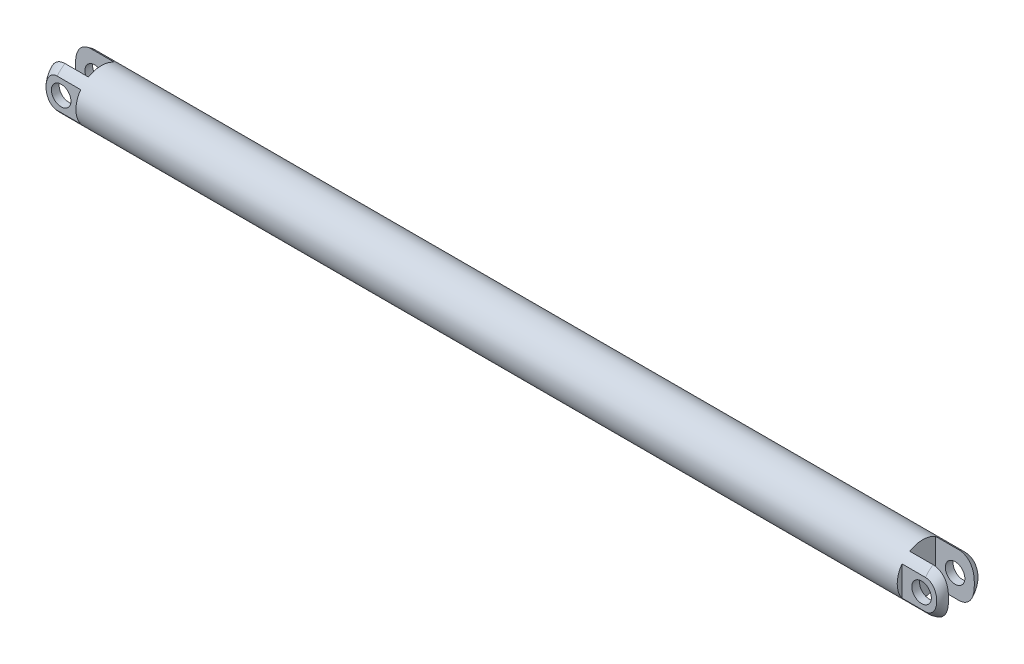
from build123d import *
from build123d.topology import SkipClean

# Parameters (mm, degrees)
SKETCH1_R            = 8.255
BOSS_EXTRUDE1_DEPTH  = 266.7
BOSS_EXTRUDE2_START  = 12.7
BOSS_EXTRUDE2_DEPTH  = 12.7
SKETCH5_R            = 3.175
CUT_EXTRUDE1_DEPTH   = 268.246525418
FILLET2_R            = 5.08
FILLET2_OF_MIRROR1_R = 5.08


with BuildPart() as part:
    # Sketch1 → Boss-Extrude1 (new body)
    with BuildSketch(Plane.YZ):
        with Locations(Location((0, 0, 0), (0, 0, 270))):
            Circle(SKETCH1_R)
    boss_extrude1 = extrude(amount=-BOSS_EXTRUDE1_DEPTH)

    # Sketch4 → Boss-Extrude2 (add)
    with SkipClean():  # the faces are left unmerged after this step: merging them gives an invalid solid
        with BuildSketch(Plane.YZ.offset(BOSS_EXTRUDE2_START)):
            with BuildLine():
                Line((-7.113903851, -4.187767543), (7.113903851, -4.187767543))
                ThreePointArc((7.113903851, -4.187767543), (6.098527778, -5.563540594), (4.821496361, -6.700611751))
                Line((4.821496361, -6.700611751), (-4.821496361, -6.700611751))
                ThreePointArc((-4.821496361, -6.700611751), (-6.098527778, -5.563540594), (-7.113903851, -4.187767543))
            make_face()
            with BuildLine():
                Line((-7.113903851, 4.187767543), (7.113903851, 4.187767543))
                ThreePointArc((7.113903851, 4.187767543), (6.098527778, 5.563540594), (4.821496361, 6.700611751))
                Line((4.821496361, 6.700611751), (-4.821496361, 6.700611751))
                ThreePointArc((-4.821496361, 6.700611751), (-6.098527778, 5.563540594), (-7.113903851, 4.187767543))
            make_face()
        boss_extrude2 = extrude(amount=-BOSS_EXTRUDE2_DEPTH)

    # Sketch5 → Cut-Extrude1 (cut, through all)
    with SkipClean():  # the faces are left unmerged after this step: merging them gives an invalid solid
        with BuildSketch(Plane.XY.offset(6.700611751)):
            with Locations((6.35, 0)):
                Circle(SKETCH5_R)
        cut_extrude1 = extrude(amount=-CUT_EXTRUDE1_DEPTH, mode=Mode.SUBTRACT)

    # Fillet2
    # the kernel refuses this fillet: 5.08 mm, written as the material it takes off along each edge
    with BuildSketch(Plane(origin=(12.7, 0, 0), x_dir=(0, 0.7924229506159141, -0.6099720217658908), z_dir=(0, 0.6099720217658908, 0.7924229506159141))) as fillet2_piece_1:
        with BuildLine():
            CenterArc((8.255 - FILLET2_R, FILLET2_R), FILLET2_R, 270, 90)
            Line((8.255 - FILLET2_R, 0), (8.255, 0))
            Line((8.255, 0), (8.255, FILLET2_R))
        make_face()
    revolve(axis=Axis((12.7, 0, 0), (-1, 0, 0)), revolution_arc=200.07814468, mode=Mode.SUBTRACT)
    with BuildSketch(Plane(origin=(12.7, 0, 0), x_dir=(0, 0.534859378845264, 0.8449410895803674), z_dir=(0, -0.8449410895803674, 0.534859378845264))) as fillet2_piece_2:
        with BuildLine():
            CenterArc((8.255 - FILLET2_R, FILLET2_R), FILLET2_R, 270, 90)
            Line((8.255 - FILLET2_R, 0), (8.255, 0))
            Line((8.255, 0), (8.255, FILLET2_R))
        make_face()
    revolve(axis=Axis((12.7, 0, 0), (-1, 0, 0)), revolution_arc=200.07814468, mode=Mode.SUBTRACT)
    with BuildSketch(Plane(origin=(12.7, 0, 0), x_dir=(0, 0.7924229506159125, 0.6099720217658933), z_dir=(0, 0.6099720217658933, -0.7924229506159125))) as fillet2_piece_3:
        with BuildLine():
            CenterArc((8.255 - FILLET2_R, -FILLET2_R), FILLET2_R, 0, 90)
            Line((8.255 - FILLET2_R, 0), (8.255, 0))
            Line((8.255, 0), (8.255, -FILLET2_R))
        make_face()
    revolve(axis=Axis((12.7, 0, 0), (1, 0, 0)), revolution_arc=200.07814468, mode=Mode.SUBTRACT)
    with BuildSketch(Plane(origin=(12.7, 0, 0), x_dir=(0, 0.534859378845264, -0.8449410895803674), z_dir=(0, -0.8449410895803674, -0.534859378845264))) as fillet2_piece_4:
        with BuildLine():
            CenterArc((8.255 - FILLET2_R, -FILLET2_R), FILLET2_R, 0, 90)
            Line((8.255 - FILLET2_R, 0), (8.255, 0))
            Line((8.255, 0), (8.255, -FILLET2_R))
        make_face()
    revolve(axis=Axis((12.7, 0, 0), (1, 0, 0)), revolution_arc=200.07814468, mode=Mode.SUBTRACT)

    # Mirror1: Boss-Extrude1, Boss-Extrude2, Cut-Extrude1 across plane
    add(boss_extrude1.mirror(Plane(origin=(-133.35, 0, 0), x_dir=(0, 0, 1), z_dir=(1, 0, 0))))
    add(boss_extrude2.mirror(Plane(origin=(-133.35, 0, 0), x_dir=(0, 0, 1), z_dir=(1, 0, 0))))
    add(cut_extrude1.mirror(Plane(origin=(-133.35, 0, 0), x_dir=(0, 0, 1), z_dir=(1, 0, 0))), mode=Mode.SUBTRACT)

    # Fillet2 of Mirror1
    # the kernel refuses this fillet: 5.08 mm, written as the material it takes off along each edge
    with BuildSketch(Plane(origin=(-279.4, 0, 0), x_dir=(0, 0.7924229506159141, -0.6099720217658908), z_dir=(0, 0.6099720217658908, 0.7924229506159141))) as fillet2_of_mirror1_piece_1:
        with BuildLine():
            CenterArc((8.255 - FILLET2_OF_MIRROR1_R, -FILLET2_OF_MIRROR1_R), FILLET2_OF_MIRROR1_R, 0, 90)
            Line((8.255 - FILLET2_OF_MIRROR1_R, 0), (8.255, 0))
            Line((8.255, 0), (8.255, -FILLET2_OF_MIRROR1_R))
        make_face()
    revolve(axis=Axis((-279.4, 0, 0), (-1, 0, 0)), revolution_arc=200.07814468, mode=Mode.SUBTRACT)
    with BuildSketch(Plane(origin=(-279.4, 0, 0), x_dir=(0, 0.534859378845264, 0.8449410895803674), z_dir=(0, -0.8449410895803674, 0.534859378845264))) as fillet2_of_mirror1_piece_2:
        with BuildLine():
            CenterArc((8.255 - FILLET2_OF_MIRROR1_R, -FILLET2_OF_MIRROR1_R), FILLET2_OF_MIRROR1_R, 0, 90)
            Line((8.255 - FILLET2_OF_MIRROR1_R, 0), (8.255, 0))
            Line((8.255, 0), (8.255, -FILLET2_OF_MIRROR1_R))
        make_face()
    revolve(axis=Axis((-279.4, 0, 0), (-1, 0, 0)), revolution_arc=200.07814468, mode=Mode.SUBTRACT)
    with BuildSketch(Plane(origin=(-279.4, 0, 0), x_dir=(0, 0.7924229506159125, 0.6099720217658933), z_dir=(0, 0.6099720217658933, -0.7924229506159125))) as fillet2_of_mirror1_piece_3:
        with BuildLine():
            CenterArc((8.255 - FILLET2_OF_MIRROR1_R, FILLET2_OF_MIRROR1_R), FILLET2_OF_MIRROR1_R, 270, 90)
            Line((8.255 - FILLET2_OF_MIRROR1_R, 0), (8.255, 0))
            Line((8.255, 0), (8.255, FILLET2_OF_MIRROR1_R))
        make_face()
    revolve(axis=Axis((-279.4, 0, 0), (1, 0, 0)), revolution_arc=200.07814468, mode=Mode.SUBTRACT)
    with BuildSketch(Plane(origin=(-279.4, 0, 0), x_dir=(0, 0.534859378845264, -0.8449410895803674), z_dir=(0, -0.8449410895803674, -0.534859378845264))) as fillet2_of_mirror1_piece_4:
        with BuildLine():
            CenterArc((8.255 - FILLET2_OF_MIRROR1_R, FILLET2_OF_MIRROR1_R), FILLET2_OF_MIRROR1_R, 270, 90)
            Line((8.255 - FILLET2_OF_MIRROR1_R, 0), (8.255, 0))
            Line((8.255, 0), (8.255, FILLET2_OF_MIRROR1_R))
        make_face()
    revolve(axis=Axis((-279.4, 0, 0), (1, 0, 0)), revolution_arc=200.07814468, mode=Mode.SUBTRACT)


solid = part.part
